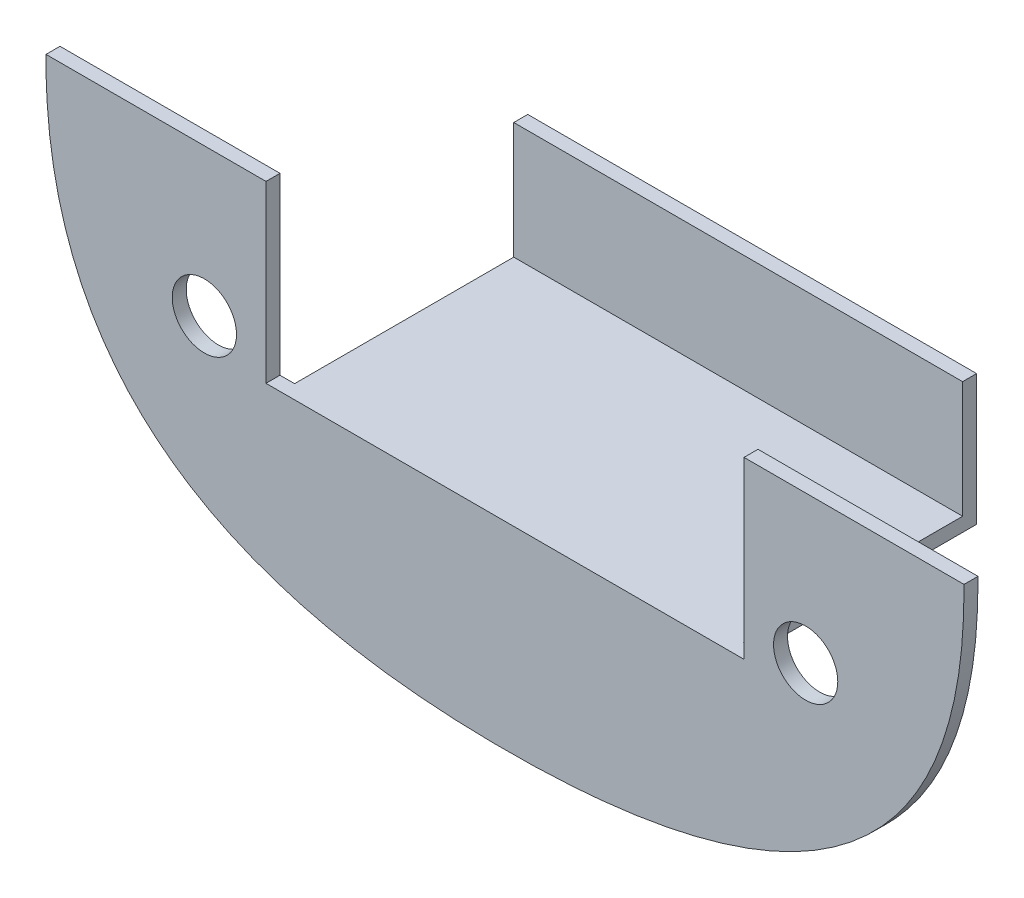
from build123d import *

# Parameters (mm, degrees)
SKETCH1_R           = 7
SKETCH1_R_2         = 7.000000001
BOSS_EXTRUDE2_DEPTH = 3.048
SKETCH2_W           = 97.79
SKETCH2_H           = 3.048
BOSS_EXTRUDE3_DEPTH = 53.848
SKETCH3_W           = 97.79
SKETCH3_H           = 3.048
BOSS_EXTRUDE4_DEPTH = 25.4


with BuildPart() as part:
    # Sketch1 → Boss-Extrude2 (new body)
    with BuildSketch(Plane(origin=(65.500000026, -188.875429159, 24.423355691), x_dir=(-1, 0, 0), z_dir=(0, 0, -1))):
        with BuildLine():
            Line((52.070000061, -36.887752409), (-52.069999939, -36.887752409))
            Line((-52.069999939, -36.887752409), (-52.069999939, 1.212247591))
            Line((-52.069999939, 1.212247591), (-100, 1.212247591))
            add(Edge.make_bspline(
                [(-100, 1.212247591), (-100, 0.808166245), (-100, 0.404084905), (-100, -3.050935477), (-99.782324229, -9.153462939), (-98.681398948, -18.249623337), (-96.670778508, -27.192813454), (-93.617739991, -35.841010852), (-89.426142687, -44.003661882), (-84.079370194, -51.464792134), (-77.672911437, -58.03689026), (-70.38836326, -63.616097619), (-62.448556374, -68.199662071), (-51.23851888, -73.075848422), (-36.478772451, -77.121799274), (-18.308403659, -79.556824284), (-6.101871014, -80), (6.101870524, -80), (18.308402672, -79.556824347), (36.478771121, -77.121799525), (51.238517744, -73.075848821), (62.448555489, -68.199662519), (70.388362626, -63.616098054), (77.672911043, -58.036890623), (84.079370017, -51.464792365), (89.426142659, -44.003661947), (93.617740043, -35.841010747), (96.670778576, -27.192813232), (98.681398994, -18.249623054), (99.782324242, -9.153462747), (100, -3.050935359), (100, 0.404083278), (100, 0.808165435), (100, 1.212247591)],
                knots=[0.139988031, 0.139988031, 0.139988031, 0.139988031, 0.141705852, 0.141705852, 0.154675936, 0.16764602, 0.180616103, 0.193586187, 0.20655627, 0.219526354, 0.232496438, 0.245466521, 0.258436605, 0.271406688, 0.297346856, 0.323287023, 0.34922719, 0.34922719, 0.375167327, 0.401107463, 0.4270476, 0.440017668, 0.452987736, 0.465957805, 0.478927873, 0.491897941, 0.50486801, 0.517838078, 0.530808146, 0.543778215, 0.556748283, 0.556748283, 0.558466107, 0.558466107, 0.558466107, 0.558466107], degree=3))
            Line((100, 1.212247591), (52.070000061, 1.212247591))
            Line((52.070000061, 1.212247591), (52.070000061, -36.887752409))
        make_face()
        with Locations((-65.5, -30.887752409)):
            Circle(SKETCH1_R, mode=Mode.SUBTRACT)
        with Locations((65.5, -30.887752409)):
            Circle(SKETCH1_R_2, mode=Mode.SUBTRACT)
    extrude(amount=BOSS_EXTRUDE2_DEPTH)

    # Sketch2 → Boss-Extrude3 (add)
    with BuildSketch(Plane.XY.offset(24.423355691)):
        with Locations((65.499999965, -227.287181568)):
            Rectangle(SKETCH2_W, SKETCH2_H)
    extrude(amount=-BOSS_EXTRUDE3_DEPTH)

    # Sketch3 → Boss-Extrude4 (add)
    with BuildSketch(Plane(origin=(0, -225.763181568, 0), x_dir=(1, 0, 0), z_dir=(0, 1, 0))):
        with Locations((65.499999965, 27.900644309)):
            Rectangle(SKETCH3_W, SKETCH3_H)
    extrude(amount=BOSS_EXTRUDE4_DEPTH)


solid = part.part
